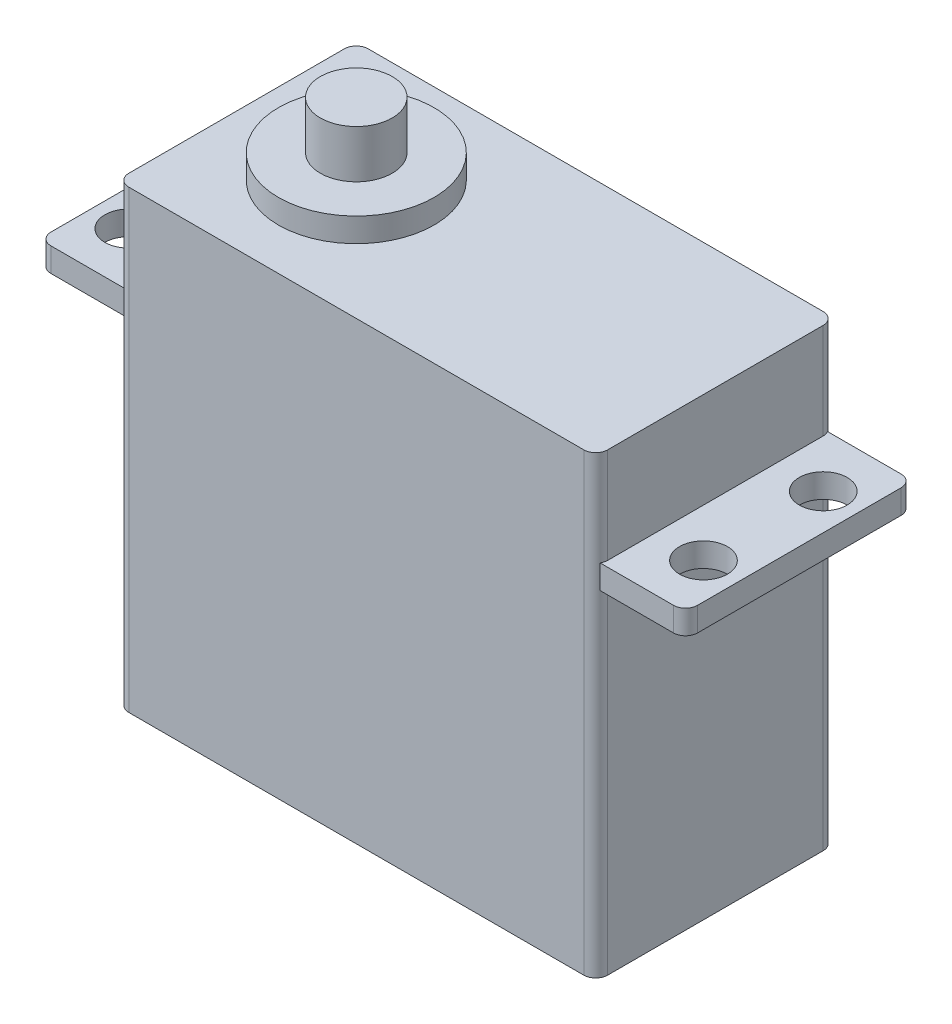
from build123d import *

# Parameters (mm, degrees)
SKETCH_1_W          = 40
SKETCH_1_H          = 20
EXTRUDE_455_DEPTH   = 38
SKETCH_2_R          = 6.5
EXTRUDE_589_DEPTH   = 2
SKETCH_3_R          = 3
EXTRUDE_676_DEPTH   = 4
SKETCH_4_W          = 19
SKETCH_4_H          = 2
EXTRUDE_1_DEPTH     = 7
SKETCH_6_W          = 19
SKETCH_6_H          = 2
EXTRUDE_2_DEPTH     = 7
SKETCH_7_R          = 2
CUT_EXTRUDE_1_DEPTH = 49.672374095
SKETCH_8_R          = 2
CUT_EXTRUDE_2_DEPTH = 49.672374095
SKETCH_9_W          = 6
SKETCH_9_H          = 4
EXTRUDE_1701_DEPTH  = 3
FILLET_1_R          = 1


with BuildPart() as part:
    # Эскиз1 → Extrude 455 (new body)
    with BuildSketch(Plane(origin=(0, 0, 0), x_dir=(1, 0, 0), z_dir=(0, 1, 0))):
        with Locations((10, 0)):
            Rectangle(SKETCH_1_W, SKETCH_1_H)
    extrude(amount=-EXTRUDE_455_DEPTH)

    # Эскиз2 → Extrude 589 (add)
    with BuildSketch(Plane(origin=(0, 0, 0), x_dir=(1, 0, 0), z_dir=(0, 1, 0))):
        with Locations(Location((0, 0, 0), (0, 0, 270))):
            Circle(SKETCH_2_R)
    extrude(amount=EXTRUDE_589_DEPTH)

    # Эскиз3 → Extrude 676 (add)
    with BuildSketch(Plane(origin=(0, 2, 0), x_dir=(1, 0, 0), z_dir=(0, 1, 0))):
        with Locations(Location((0, 0, 0), (0, 0, 270))):
            Circle(SKETCH_3_R)
    extrude(amount=EXTRUDE_676_DEPTH)

    # Эскиз4 → крепления 1 (add)
    with BuildSketch(Plane(origin=(30, 0, 0), x_dir=(0, 0, -1), z_dir=(1, 0, 0))):
        with Locations((0, -9)):
            Rectangle(SKETCH_4_W, SKETCH_4_H)
    extrude(amount=EXTRUDE_1_DEPTH)

    # Эскиз6 → крепления 2 (add)
    with BuildSketch(Plane.ZY.offset(10)):
        with Locations((0, -9)):
            Rectangle(SKETCH_6_W, SKETCH_6_H)
    extrude(amount=EXTRUDE_2_DEPTH)

    # Эскиз7 → отверстия 1 (cut, through all)
    with BuildSketch(Plane(origin=(0, -8, 0), x_dir=(1, 0, 0), z_dir=(0, 1, 0))):
        with Locations(Location((34, 5, 0), (0, 0, 270))):
            Circle(SKETCH_7_R)
        with Locations(Location((34, -5, 0), (0, 0, 270))):
            Circle(SKETCH_7_R)
    extrude(amount=-CUT_EXTRUDE_1_DEPTH, mode=Mode.SUBTRACT)

    # Эскиз8 → отверстия 2 (cut, through all)
    with BuildSketch(Plane(origin=(0, -8, 0), x_dir=(1, 0, 0), z_dir=(0, 1, 0))):
        with Locations(Location((-14, 5, 0), (0, 0, 270))):
            Circle(SKETCH_8_R)
        with Locations(Location((-14, -5, 0), (0, 0, 270))):
            Circle(SKETCH_8_R)
    extrude(amount=-CUT_EXTRUDE_2_DEPTH, mode=Mode.SUBTRACT)

    # Эскиз9 → Extrude 1701 (add)
    with BuildSketch(Plane.ZY.offset(10)):
        with Locations((0, -33)):
            Rectangle(SKETCH_9_W, SKETCH_9_H)
    extrude(amount=EXTRUDE_1701_DEPTH)

    # Скругление1
    # the kernel refuses this fillet: 1 mm, written as the material it takes off along each edge
    with BuildSketch(Plane(origin=(30, 2.5, 10), x_dir=(0, 0, -1), z_dir=(0, -1, 0))) as fillet_1_piece_1_section:
        with BuildLine():
            CenterArc((FILLET_1_R, -FILLET_1_R), FILLET_1_R, 90, 90)
            Line((0, -FILLET_1_R), (0, 0))
            Line((0, 0), (FILLET_1_R, 0))
        make_face()
    fillet_1_piece_1 = extrude(amount=43, mode=Mode.PRIVATE)
    fillet_1_piece_1 = split(fillet_1_piece_1, bisect_by=Plane(origin=(29.975991618, -8, 9.336749215), z_dir=(0, 1, 0)), keep=Keep.TOP, mode=Mode.PRIVATE)
    fillet_1_piece_1 = split(fillet_1_piece_1, bisect_by=Plane(origin=(29.975991618, -2.75, 9.5), z_dir=(0, 0, -1)), keep=Keep.TOP, mode=Mode.PRIVATE)
    add(fillet_1_piece_1, mode=Mode.SUBTRACT)
    with BuildSketch(Plane(origin=(30, 2.5, 10), x_dir=(0, 0, -1), z_dir=(0, -1, 0))) as fillet_1_piece_2_section:
        with BuildLine():
            CenterArc((FILLET_1_R, -FILLET_1_R), FILLET_1_R, 90, 90)
            Line((0, -FILLET_1_R), (0, 0))
            Line((0, 0), (FILLET_1_R, 0))
        make_face()
    fillet_1_piece_2 = extrude(amount=43, mode=Mode.PRIVATE)
    fillet_1_piece_2 = split(fillet_1_piece_2, bisect_by=Plane(origin=(29.74487994, -8, 9.835608236), z_dir=(0, 1, 0)), keep=Keep.TOP, mode=Mode.PRIVATE)
    fillet_1_piece_2 = split(fillet_1_piece_2, bisect_by=Plane(origin=(29.74487994, -2.75, 9.5), z_dir=(0, 0, 1)), keep=Keep.TOP, mode=Mode.PRIVATE)
    add(fillet_1_piece_2, mode=Mode.SUBTRACT)
    with BuildSketch(Plane(origin=(30, 2.5, 10), x_dir=(0, 0, -1), z_dir=(0, -1, 0))) as fillet_1_piece_3_section:
        with BuildLine():
            CenterArc((FILLET_1_R, -FILLET_1_R), FILLET_1_R, 90, 90)
            Line((0, -FILLET_1_R), (0, 0))
            Line((0, 0), (FILLET_1_R, 0))
        make_face()
    fillet_1_piece_3 = extrude(amount=43, mode=Mode.PRIVATE)
    fillet_1_piece_3 = split(fillet_1_piece_3, bisect_by=Plane(origin=(29.74487994, -8, 9.835608236), z_dir=(0, -1, 0)), keep=Keep.TOP, mode=Mode.PRIVATE)
    fillet_1_piece_3 = split(fillet_1_piece_3, bisect_by=Plane(origin=(29.74487994, -10, 9.835608236), z_dir=(0, 1, 0)), keep=Keep.TOP, mode=Mode.PRIVATE)
    fillet_1_piece_3 = split(fillet_1_piece_3, bisect_by=Plane(origin=(29.74487994, -9, 9.5), z_dir=(0, 0, 1)), keep=Keep.TOP, mode=Mode.PRIVATE)
    add(fillet_1_piece_3, mode=Mode.SUBTRACT)
    with BuildSketch(Plane(origin=(30, 2.5, 10), x_dir=(0, 0, -1), z_dir=(0, -1, 0))) as fillet_1_piece_4_section:
        with BuildLine():
            CenterArc((FILLET_1_R, -FILLET_1_R), FILLET_1_R, 90, 90)
            Line((0, -FILLET_1_R), (0, 0))
            Line((0, 0), (FILLET_1_R, 0))
        make_face()
    fillet_1_piece_4 = extrude(amount=43, mode=Mode.PRIVATE)
    fillet_1_piece_4 = split(fillet_1_piece_4, bisect_by=Plane(origin=(29.975991618, -10, 9.336749215), z_dir=(0, -1, 0)), keep=Keep.TOP, mode=Mode.PRIVATE)
    fillet_1_piece_4 = split(fillet_1_piece_4, bisect_by=Plane(origin=(29.975991618, -25.25, 9.5), z_dir=(0, 0, -1)), keep=Keep.TOP, mode=Mode.PRIVATE)
    add(fillet_1_piece_4, mode=Mode.SUBTRACT)
    with BuildSketch(Plane(origin=(30, 2.5, 10), x_dir=(0, 0, -1), z_dir=(0, -1, 0))) as fillet_1_piece_5_section:
        with BuildLine():
            CenterArc((FILLET_1_R, -FILLET_1_R), FILLET_1_R, 90, 90)
            Line((0, -FILLET_1_R), (0, 0))
            Line((0, 0), (FILLET_1_R, 0))
        make_face()
    fillet_1_piece_5 = extrude(amount=43, mode=Mode.PRIVATE)
    fillet_1_piece_5 = split(fillet_1_piece_5, bisect_by=Plane(origin=(29.74487994, -10, 9.835608236), z_dir=(0, -1, 0)), keep=Keep.TOP, mode=Mode.PRIVATE)
    fillet_1_piece_5 = split(fillet_1_piece_5, bisect_by=Plane(origin=(29.74487994, -25.25, 9.5), z_dir=(0, 0, 1)), keep=Keep.TOP, mode=Mode.PRIVATE)
    add(fillet_1_piece_5, mode=Mode.SUBTRACT)
    with BuildSketch(Plane(origin=(30, 2.5, -10), x_dir=(-1, 0, 0), z_dir=(0, -1, 0))) as fillet_1_piece_6_section:
        with BuildLine():
            CenterArc((FILLET_1_R, -FILLET_1_R), FILLET_1_R, 90, 90)
            Line((0, -FILLET_1_R), (0, 0))
            Line((0, 0), (FILLET_1_R, 0))
        make_face()
    fillet_1_piece_6 = extrude(amount=43, mode=Mode.PRIVATE)
    fillet_1_piece_6 = split(fillet_1_piece_6, bisect_by=Plane(origin=(29.74487994, -8, -9.835608236), z_dir=(0, 1, 0)), keep=Keep.TOP, mode=Mode.PRIVATE)
    fillet_1_piece_6 = split(fillet_1_piece_6, bisect_by=Plane(origin=(29.74487994, -2.75, -9.5), z_dir=(0, 0, -1)), keep=Keep.TOP, mode=Mode.PRIVATE)
    add(fillet_1_piece_6, mode=Mode.SUBTRACT)
    with BuildSketch(Plane(origin=(30, 2.5, -10), x_dir=(-1, 0, 0), z_dir=(0, -1, 0))) as fillet_1_piece_7_section:
        with BuildLine():
            CenterArc((FILLET_1_R, -FILLET_1_R), FILLET_1_R, 90, 90)
            Line((0, -FILLET_1_R), (0, 0))
            Line((0, 0), (FILLET_1_R, 0))
        make_face()
    fillet_1_piece_7 = extrude(amount=43, mode=Mode.PRIVATE)
    fillet_1_piece_7 = split(fillet_1_piece_7, bisect_by=Plane(origin=(29.975991618, -8, -9.336749215), z_dir=(0, 1, 0)), keep=Keep.TOP, mode=Mode.PRIVATE)
    fillet_1_piece_7 = split(fillet_1_piece_7, bisect_by=Plane(origin=(29.975991618, -2.75, -9.5), z_dir=(0, 0, 1)), keep=Keep.TOP, mode=Mode.PRIVATE)
    add(fillet_1_piece_7, mode=Mode.SUBTRACT)
    with BuildSketch(Plane(origin=(30, 2.5, -10), x_dir=(-1, 0, 0), z_dir=(0, -1, 0))) as fillet_1_piece_8_section:
        with BuildLine():
            CenterArc((FILLET_1_R, -FILLET_1_R), FILLET_1_R, 90, 90)
            Line((0, -FILLET_1_R), (0, 0))
            Line((0, 0), (FILLET_1_R, 0))
        make_face()
    fillet_1_piece_8 = extrude(amount=43, mode=Mode.PRIVATE)
    fillet_1_piece_8 = split(fillet_1_piece_8, bisect_by=Plane(origin=(29.74487994, -8, -9.835608236), z_dir=(0, -1, 0)), keep=Keep.TOP, mode=Mode.PRIVATE)
    fillet_1_piece_8 = split(fillet_1_piece_8, bisect_by=Plane(origin=(29.74487994, -9, -9.5), z_dir=(0, 0, -1)), keep=Keep.TOP, mode=Mode.PRIVATE)
    fillet_1_piece_8 = split(fillet_1_piece_8, bisect_by=Plane(origin=(29.74487994, -10, -9.835608236), z_dir=(0, 1, 0)), keep=Keep.TOP, mode=Mode.PRIVATE)
    add(fillet_1_piece_8, mode=Mode.SUBTRACT)
    with BuildSketch(Plane(origin=(30, 2.5, -10), x_dir=(-1, 0, 0), z_dir=(0, -1, 0))) as fillet_1_piece_9_section:
        with BuildLine():
            CenterArc((FILLET_1_R, -FILLET_1_R), FILLET_1_R, 90, 90)
            Line((0, -FILLET_1_R), (0, 0))
            Line((0, 0), (FILLET_1_R, 0))
        make_face()
    fillet_1_piece_9 = extrude(amount=43, mode=Mode.PRIVATE)
    fillet_1_piece_9 = split(fillet_1_piece_9, bisect_by=Plane(origin=(29.74487994, -25.25, -9.5), z_dir=(0, 0, -1)), keep=Keep.TOP, mode=Mode.PRIVATE)
    fillet_1_piece_9 = split(fillet_1_piece_9, bisect_by=Plane(origin=(29.74487994, -10, -9.835608236), z_dir=(0, -1, 0)), keep=Keep.TOP, mode=Mode.PRIVATE)
    add(fillet_1_piece_9, mode=Mode.SUBTRACT)
    with BuildSketch(Plane(origin=(30, 2.5, -10), x_dir=(-1, 0, 0), z_dir=(0, -1, 0))) as fillet_1_piece_10_section:
        with BuildLine():
            CenterArc((FILLET_1_R, -FILLET_1_R), FILLET_1_R, 90, 90)
            Line((0, -FILLET_1_R), (0, 0))
            Line((0, 0), (FILLET_1_R, 0))
        make_face()
    fillet_1_piece_10 = extrude(amount=43, mode=Mode.PRIVATE)
    fillet_1_piece_10 = split(fillet_1_piece_10, bisect_by=Plane(origin=(29.975991618, -25.25, -9.5), z_dir=(0, 0, 1)), keep=Keep.TOP, mode=Mode.PRIVATE)
    fillet_1_piece_10 = split(fillet_1_piece_10, bisect_by=Plane(origin=(29.975991618, -10, -9.336749215), z_dir=(0, -1, 0)), keep=Keep.TOP, mode=Mode.PRIVATE)
    add(fillet_1_piece_10, mode=Mode.SUBTRACT)
    with BuildSketch(Plane(origin=(37, -5.5, -9.5), x_dir=(-1, 0, 0), z_dir=(0, -1, 0)), Plane(origin=(37, -12.5, 9.5), x_dir=(-1, 0, 0), z_dir=(0, 1, 0)), Plane(origin=(-17, -12.5, -9.5), x_dir=(1, 0, 0), z_dir=(0, 1, 0)), Plane(origin=(-17, -5.5, 9.5), x_dir=(1, 0, 0), z_dir=(0, -1, 0))) as fillet_1_piece_11:
        with BuildLine():
            CenterArc((FILLET_1_R, -FILLET_1_R), FILLET_1_R, 90, 90)
            Line((0, -FILLET_1_R), (0, 0))
            Line((0, 0), (FILLET_1_R, 0))
        make_face()
    extrude(amount=7, mode=Mode.SUBTRACT)
    with BuildSketch(Plane(origin=(-10, 2.5, 10), x_dir=(0, 0, -1), z_dir=(0, -1, 0))) as fillet_1_piece_12_section:
        with BuildLine():
            CenterArc((FILLET_1_R, FILLET_1_R), FILLET_1_R, 180, 90)
            Line((0, FILLET_1_R), (0, 0))
            Line((0, 0), (FILLET_1_R, 0))
        make_face()
    fillet_1_piece_12 = extrude(amount=43, mode=Mode.PRIVATE)
    fillet_1_piece_12 = split(fillet_1_piece_12, bisect_by=Plane(origin=(-9.975991618, -8, 9.336749215), z_dir=(0, 1, 0)), keep=Keep.TOP, mode=Mode.PRIVATE)
    fillet_1_piece_12 = split(fillet_1_piece_12, bisect_by=Plane(origin=(-9.975991618, -2.75, 9.5), z_dir=(0, 0, -1)), keep=Keep.TOP, mode=Mode.PRIVATE)
    add(fillet_1_piece_12, mode=Mode.SUBTRACT)
    with BuildSketch(Plane(origin=(-10, 2.5, 10), x_dir=(0, 0, -1), z_dir=(0, -1, 0))) as fillet_1_piece_13_section:
        with BuildLine():
            CenterArc((FILLET_1_R, FILLET_1_R), FILLET_1_R, 180, 90)
            Line((0, FILLET_1_R), (0, 0))
            Line((0, 0), (FILLET_1_R, 0))
        make_face()
    fillet_1_piece_13 = extrude(amount=43, mode=Mode.PRIVATE)
    fillet_1_piece_13 = split(fillet_1_piece_13, bisect_by=Plane(origin=(-9.74487994, -8, 9.835608236), z_dir=(0, 1, 0)), keep=Keep.TOP, mode=Mode.PRIVATE)
    fillet_1_piece_13 = split(fillet_1_piece_13, bisect_by=Plane(origin=(-9.74487994, -2.75, 9.5), z_dir=(0, 0, 1)), keep=Keep.TOP, mode=Mode.PRIVATE)
    add(fillet_1_piece_13, mode=Mode.SUBTRACT)
    with BuildSketch(Plane(origin=(-10, 2.5, 10), x_dir=(0, 0, -1), z_dir=(0, -1, 0))) as fillet_1_piece_14_section:
        with BuildLine():
            CenterArc((FILLET_1_R, FILLET_1_R), FILLET_1_R, 180, 90)
            Line((0, FILLET_1_R), (0, 0))
            Line((0, 0), (FILLET_1_R, 0))
        make_face()
    fillet_1_piece_14 = extrude(amount=43, mode=Mode.PRIVATE)
    fillet_1_piece_14 = split(fillet_1_piece_14, bisect_by=Plane(origin=(-9.74487994, -8, 9.835608236), z_dir=(0, -1, 0)), keep=Keep.TOP, mode=Mode.PRIVATE)
    fillet_1_piece_14 = split(fillet_1_piece_14, bisect_by=Plane(origin=(-9.74487994, -9, 9.5), z_dir=(0, 0, 1)), keep=Keep.TOP, mode=Mode.PRIVATE)
    fillet_1_piece_14 = split(fillet_1_piece_14, bisect_by=Plane(origin=(-9.74487994, -10, 9.835608236), z_dir=(0, 1, 0)), keep=Keep.TOP, mode=Mode.PRIVATE)
    add(fillet_1_piece_14, mode=Mode.SUBTRACT)
    with BuildSketch(Plane(origin=(-10, 2.5, 10), x_dir=(0, 0, -1), z_dir=(0, -1, 0))) as fillet_1_piece_15_section:
        with BuildLine():
            CenterArc((FILLET_1_R, FILLET_1_R), FILLET_1_R, 180, 90)
            Line((0, FILLET_1_R), (0, 0))
            Line((0, 0), (FILLET_1_R, 0))
        make_face()
    fillet_1_piece_15 = extrude(amount=43, mode=Mode.PRIVATE)
    fillet_1_piece_15 = split(fillet_1_piece_15, bisect_by=Plane(origin=(-9.975991618, -25.25, 9.5), z_dir=(0, 0, -1)), keep=Keep.TOP, mode=Mode.PRIVATE)
    fillet_1_piece_15 = split(fillet_1_piece_15, bisect_by=Plane(origin=(-9.975991618, -10, 9.336749215), z_dir=(0, -1, 0)), keep=Keep.TOP, mode=Mode.PRIVATE)
    add(fillet_1_piece_15, mode=Mode.SUBTRACT)
    with BuildSketch(Plane(origin=(-10, 2.5, 10), x_dir=(0, 0, -1), z_dir=(0, -1, 0))) as fillet_1_piece_16_section:
        with BuildLine():
            CenterArc((FILLET_1_R, FILLET_1_R), FILLET_1_R, 180, 90)
            Line((0, FILLET_1_R), (0, 0))
            Line((0, 0), (FILLET_1_R, 0))
        make_face()
    fillet_1_piece_16 = extrude(amount=43, mode=Mode.PRIVATE)
    fillet_1_piece_16 = split(fillet_1_piece_16, bisect_by=Plane(origin=(-9.74487994, -25.25, 9.5), z_dir=(0, 0, 1)), keep=Keep.TOP, mode=Mode.PRIVATE)
    fillet_1_piece_16 = split(fillet_1_piece_16, bisect_by=Plane(origin=(-9.74487994, -10, 9.835608236), z_dir=(0, -1, 0)), keep=Keep.TOP, mode=Mode.PRIVATE)
    add(fillet_1_piece_16, mode=Mode.SUBTRACT)
    with BuildSketch(Plane(origin=(-10, 2.5, -10), x_dir=(1, 0, 0), z_dir=(0, -1, 0))) as fillet_1_piece_17_section:
        with BuildLine():
            CenterArc((FILLET_1_R, FILLET_1_R), FILLET_1_R, 180, 90)
            Line((0, FILLET_1_R), (0, 0))
            Line((0, 0), (FILLET_1_R, 0))
        make_face()
    fillet_1_piece_17 = extrude(amount=43, mode=Mode.PRIVATE)
    fillet_1_piece_17 = split(fillet_1_piece_17, bisect_by=Plane(origin=(-9.74487994, -8, -9.835608236), z_dir=(0, 1, 0)), keep=Keep.TOP, mode=Mode.PRIVATE)
    fillet_1_piece_17 = split(fillet_1_piece_17, bisect_by=Plane(origin=(-9.74487994, -2.75, -9.5), z_dir=(0, 0, -1)), keep=Keep.TOP, mode=Mode.PRIVATE)
    add(fillet_1_piece_17, mode=Mode.SUBTRACT)
    with BuildSketch(Plane(origin=(-10, 2.5, -10), x_dir=(1, 0, 0), z_dir=(0, -1, 0))) as fillet_1_piece_18_section:
        with BuildLine():
            CenterArc((FILLET_1_R, FILLET_1_R), FILLET_1_R, 180, 90)
            Line((0, FILLET_1_R), (0, 0))
            Line((0, 0), (FILLET_1_R, 0))
        make_face()
    fillet_1_piece_18 = extrude(amount=43, mode=Mode.PRIVATE)
    fillet_1_piece_18 = split(fillet_1_piece_18, bisect_by=Plane(origin=(-9.975991618, -8, -9.336749215), z_dir=(0, 1, 0)), keep=Keep.TOP, mode=Mode.PRIVATE)
    fillet_1_piece_18 = split(fillet_1_piece_18, bisect_by=Plane(origin=(-9.975991618, -2.75, -9.5), z_dir=(0, 0, 1)), keep=Keep.TOP, mode=Mode.PRIVATE)
    add(fillet_1_piece_18, mode=Mode.SUBTRACT)
    with BuildSketch(Plane(origin=(-10, 2.5, -10), x_dir=(1, 0, 0), z_dir=(0, -1, 0))) as fillet_1_piece_19_section:
        with BuildLine():
            CenterArc((FILLET_1_R, FILLET_1_R), FILLET_1_R, 180, 90)
            Line((0, FILLET_1_R), (0, 0))
            Line((0, 0), (FILLET_1_R, 0))
        make_face()
    fillet_1_piece_19 = extrude(amount=43, mode=Mode.PRIVATE)
    fillet_1_piece_19 = split(fillet_1_piece_19, bisect_by=Plane(origin=(-9.74487994, -8, -9.835608236), z_dir=(0, -1, 0)), keep=Keep.TOP, mode=Mode.PRIVATE)
    fillet_1_piece_19 = split(fillet_1_piece_19, bisect_by=Plane(origin=(-9.74487994, -9, -9.5), z_dir=(0, 0, -1)), keep=Keep.TOP, mode=Mode.PRIVATE)
    fillet_1_piece_19 = split(fillet_1_piece_19, bisect_by=Plane(origin=(-9.74487994, -10, -9.835608236), z_dir=(0, 1, 0)), keep=Keep.TOP, mode=Mode.PRIVATE)
    add(fillet_1_piece_19, mode=Mode.SUBTRACT)
    with BuildSketch(Plane(origin=(-10, 2.5, -10), x_dir=(1, 0, 0), z_dir=(0, -1, 0))) as fillet_1_piece_20_section:
        with BuildLine():
            CenterArc((FILLET_1_R, FILLET_1_R), FILLET_1_R, 180, 90)
            Line((0, FILLET_1_R), (0, 0))
            Line((0, 0), (FILLET_1_R, 0))
        make_face()
    fillet_1_piece_20 = extrude(amount=43, mode=Mode.PRIVATE)
    fillet_1_piece_20 = split(fillet_1_piece_20, bisect_by=Plane(origin=(-9.74487994, -25.25, -9.5), z_dir=(0, 0, -1)), keep=Keep.TOP, mode=Mode.PRIVATE)
    fillet_1_piece_20 = split(fillet_1_piece_20, bisect_by=Plane(origin=(-9.74487994, -10, -9.835608236), z_dir=(0, -1, 0)), keep=Keep.TOP, mode=Mode.PRIVATE)
    add(fillet_1_piece_20, mode=Mode.SUBTRACT)
    with BuildSketch(Plane(origin=(-10, 2.5, -10), x_dir=(1, 0, 0), z_dir=(0, -1, 0))) as fillet_1_piece_21_section:
        with BuildLine():
            CenterArc((FILLET_1_R, FILLET_1_R), FILLET_1_R, 180, 90)
            Line((0, FILLET_1_R), (0, 0))
            Line((0, 0), (FILLET_1_R, 0))
        make_face()
    fillet_1_piece_21 = extrude(amount=43, mode=Mode.PRIVATE)
    fillet_1_piece_21 = split(fillet_1_piece_21, bisect_by=Plane(origin=(-9.975991618, -25.25, -9.5), z_dir=(0, 0, 1)), keep=Keep.TOP, mode=Mode.PRIVATE)
    fillet_1_piece_21 = split(fillet_1_piece_21, bisect_by=Plane(origin=(-9.975991618, -10, -9.336749215), z_dir=(0, -1, 0)), keep=Keep.TOP, mode=Mode.PRIVATE)
    add(fillet_1_piece_21, mode=Mode.SUBTRACT)


solid = part.part
